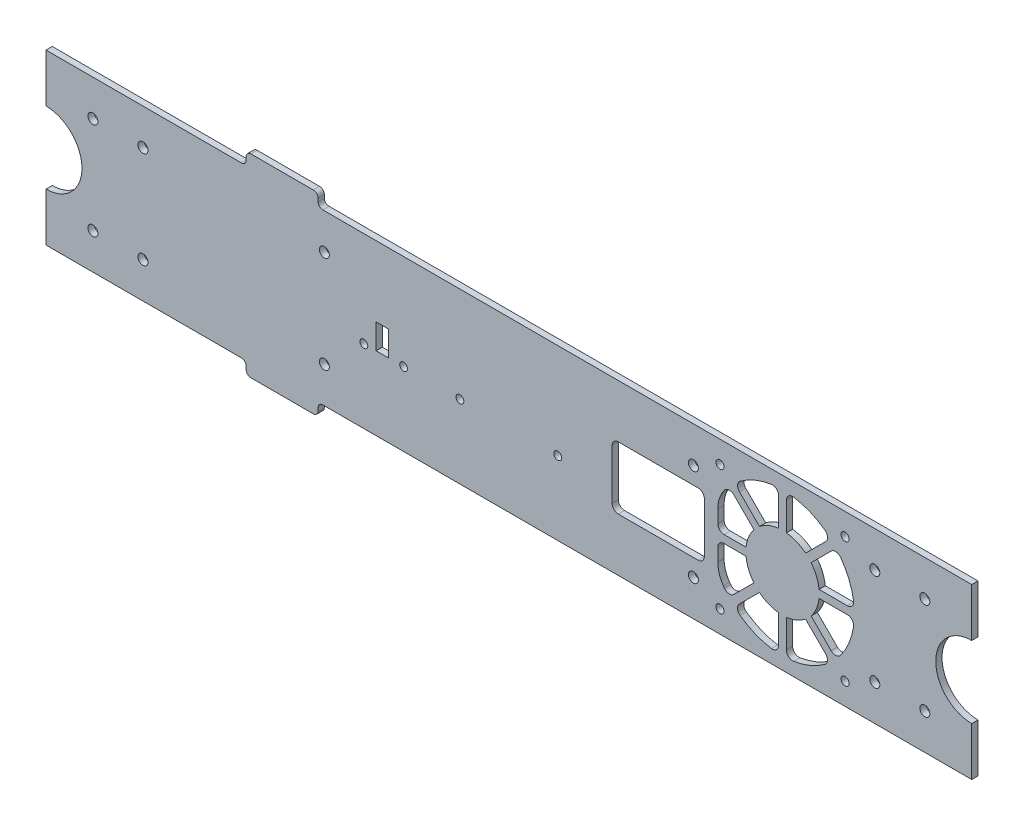
from build123d import *

# Parameters (mm, degrees)
SZKIC1_R                    = 1.6
SZKIC1_R_2                  = 1.25
SZKIC1_R_3                  = 1.3
SZKIC1_W                    = 4
SZKIC1_H                    = 8
DODANIE_WYCI_GNI_CIE2_DEPTH = 2


with BuildPart() as part:
    # Szkic1 → Dodanie-wyciągnięcie2 (new body)
    with BuildSketch(Plane.XY):
        with BuildLine():
            Line((-157.380716887, 25.645761596), (-157.380716887, 10.145761596))
            ThreePointArc((-157.380716887, 10.145761596), (-145.880716887, -1.354238404), (-157.380716887, -12.854238404))
            Line((-157.380716887, -12.854238404), (-157.380716887, -28.354238404))
            Line((-157.380716887, -28.354238404), (-94.880716887, -28.354238404))
            ThreePointArc((-94.880716887, -28.354238404), (-93.820056715, -28.793578232), (-93.380716887, -29.854238404))
            Line((-93.380716887, -29.854238404), (-93.380716887, -30.854238404))
            ThreePointArc((-93.380716887, -30.854238404), (-92.941377059, -31.914898575), (-91.880716887, -32.354238404))
            Line((-91.880716887, -32.354238404), (-71.880716887, -32.354238404))
            ThreePointArc((-71.880716887, -32.354238404), (-70.820056715, -31.914898575), (-70.380716887, -30.854238404))
            Line((-70.380716887, -30.854238404), (-70.380716887, -29.854238404))
            ThreePointArc((-70.380716887, -29.854238404), (-69.941377059, -28.793578232), (-68.880716887, -28.354238404))
            Line((-68.880716887, -28.354238404), (-54.387814563, -28.354238404))
            Line((-54.387814563, -28.354238404), (10.612185437, -28.354238404))
            Line((10.612185437, -28.354238404), (49.612185437, -28.354238404))
            Line((49.612185437, -28.354238404), (76.612185437, -28.354238404))
            Line((76.612185437, -28.354238404), (138.619283113, -28.354238404))
            Line((138.619283113, -28.354238404), (138.619283113, -12.854238404))
            ThreePointArc((138.619283113, -12.854238404), (127.119283113, -1.354238404), (138.619283113, 10.145761596))
            Line((138.619283113, 10.145761596), (138.619283113, 25.645761596))
            Line((138.619283113, 25.645761596), (76.612185437, 25.645761596))
            Line((76.612185437, 25.645761596), (49.612185437, 25.645761596))
            Line((49.612185437, 25.645761596), (-68.880716887, 25.645761596))
            ThreePointArc((-68.880716887, 25.645761596), (-69.941377059, 26.085101425), (-70.380716887, 27.145761596))
            Line((-70.380716887, 27.145761596), (-70.380716887, 28.145761596))
            ThreePointArc((-70.380716887, 28.145761596), (-70.820056715, 29.206421768), (-71.880716887, 29.645761596))
            Line((-71.880716887, 29.645761596), (-91.880716887, 29.645761596))
            ThreePointArc((-91.880716887, 29.645761596), (-92.941377059, 29.206421768), (-93.380716887, 28.145761596))
            Line((-93.380716887, 28.145761596), (-93.380716887, 27.145761596))
            ThreePointArc((-93.380716887, 27.145761596), (-93.820056715, 26.085101425), (-94.880716887, 25.645761596))
            Line((-94.880716887, 25.645761596), (-157.380716887, 25.645761596))
        make_face()
        with Locations((-126.387814563, -16.854238404)):
            Circle(SZKIC1_R, mode=Mode.SUBTRACT)
        with Locations((-126.380716887, 14.145761596)):
            Circle(SZKIC1_R, mode=Mode.SUBTRACT)
        with Locations((107.619283113, -16.854238404)):
            Circle(SZKIC1_R, mode=Mode.SUBTRACT)
        with Locations((107.619283113, 14.145761596)):
            Circle(SZKIC1_R, mode=Mode.SUBTRACT)
        with Locations((123.619283113, -16.854238404)):
            Circle(SZKIC1_R, mode=Mode.SUBTRACT)
        with Locations((123.619283113, 14.145761596)):
            Circle(SZKIC1_R, mode=Mode.SUBTRACT)
        with Locations((-142.387814563, -16.854237591)):
            Circle(SZKIC1_R, mode=Mode.SUBTRACT)
        with Locations((-142.380716887, 14.145761596)):
            Circle(SZKIC1_R, mode=Mode.SUBTRACT)
        with Locations((-43.037814563, -4.85389443)):
            Circle(SZKIC1_R_2, mode=Mode.SUBTRACT)
        with Locations((-25.037814563, -4.85389443)):
            Circle(SZKIC1_R_2, mode=Mode.SUBTRACT)
        with Locations((6.262185437, -4.85389443)):
            Circle(SZKIC1_R_2, mode=Mode.SUBTRACT)
        with Locations((58.119283113, -21.354238404)):
            Circle(SZKIC1_R_3, mode=Mode.SUBTRACT)
        with Locations((98.119283113, -21.354238404)):
            Circle(SZKIC1_R_3, mode=Mode.SUBTRACT)
        with Locations((98.119283113, 18.645761596)):
            Circle(SZKIC1_R_3, mode=Mode.SUBTRACT)
        with Locations((58.119283113, 18.645761596)):
            Circle(SZKIC1_R_3, mode=Mode.SUBTRACT)
        with Locations((-68.387814563, -16.854238404)):
            Circle(SZKIC1_R, mode=Mode.SUBTRACT)
        with Locations((-68.380716887, 14.145761596)):
            Circle(SZKIC1_R, mode=Mode.SUBTRACT)
        with Locations((49.619283113, -16.854238404)):
            Circle(SZKIC1_R, mode=Mode.SUBTRACT)
        with Locations((49.619283113, 14.145761596)):
            Circle(SZKIC1_R, mode=Mode.SUBTRACT)
        with Locations((-55.737814563, -4.85389443)):
            Circle(SZKIC1_R_2, mode=Mode.SUBTRACT)
        with BuildLine():
            Line((79.369283113, 19.384985726), (79.369283113, 10.329083042))
            ThreePointArc((79.369283113, 10.329083042), (82.616090095, 9.501231506), (85.497221579, 7.790624854))
            Line((85.497221579, 7.790624854), (91.906777401, 14.198994674))
            ThreePointArc((91.906777401, 14.198994674), (92.486674036, 15.768408091), (91.671114848, 17.229298844))
            ThreePointArc((91.671114848, 17.229298844), (86.925664761, 19.89305889), (81.687208557, 21.367335222))
            ThreePointArc((81.687208557, 21.367335222), (80.07170559, 20.909984733), (79.369283113, 19.384985726))
        make_face(mode=Mode.SUBTRACT)
        with BuildLine():
            Line((76.869283113, 19.393093303), (76.869283113, 10.329083042))
            ThreePointArc((76.869283113, 10.329083042), (73.623255004, 9.501554117), (70.74265698, 7.791683469))
            Line((70.74265698, 7.791683469), (64.334270116, 14.201256338))
            ThreePointArc((64.334270116, 14.201256338), (63.754662098, 15.770753709), (64.570455611, 17.231489275))
            ThreePointArc((64.570455611, 17.231489275), (69.31872127, 19.895470094), (74.560131496, 21.368711224))
            ThreePointArc((74.560131496, 21.368711224), (76.169581668, 20.912570792), (76.869283113, 19.393093303))
        make_face(mode=Mode.SUBTRACT)
        with BuildLine():
            Line((98.858507242, -0.104238404), (89.802604559, -0.104238404))
            ThreePointArc((89.802604559, -0.104238404), (88.974982211, 3.142015271), (87.264898428, 6.022767799))
            Line((87.264898428, 6.022767799), (93.674488351, 12.431171714))
            ThreePointArc((93.674488351, 12.431171714), (95.24396239, 13.01078155), (96.704693716, 12.195024039))
            ThreePointArc((96.704693716, 12.195024039), (99.367189094, 7.45067451), (100.840856739, 2.21368704))
            ThreePointArc((100.840856739, 2.21368704), (100.38350625, 0.598184073), (98.858507242, -0.104238404))
        make_face(mode=Mode.SUBTRACT)
        with BuildLine():
            Line((98.859839097, -2.604238404), (89.802604559, -2.604238404))
            ThreePointArc((89.802604559, -2.604238404), (88.972820396, -5.855707993), (87.257804535, -8.74003059))
            Line((87.257804535, -8.74003059), (93.666527985, -15.149940107))
            ThreePointArc((93.666527985, -15.149940107), (95.235459057, -15.729874195), (96.69626185, -14.915059213))
            ThreePointArc((96.69626185, -14.915059213), (99.364729025, -10.165085583), (100.841083042, -4.920722383))
            ThreePointArc((100.841083042, -4.920722383), (100.383931089, -3.306213804), (98.859839097, -2.604238404))
        make_face(mode=Mode.SUBTRACT)
        with BuildLine():
            Line((66.435961668, -0.104238404), (59.419283113, -0.104238404))
            ThreePointArc((59.419283113, -0.104238404), (58.005069551, 0.481548034), (57.419283113, 1.895761596))
            Line((57.419283113, 1.895761596), (57.419283113, 6.028850381))
            ThreePointArc((57.419283113, 6.028850381), (57.871830775, 9.003098832), (59.188513882, 11.708149446))
            ThreePointArc((59.188513882, 11.708149446), (59.360689238, 11.954223409), (59.536063013, 12.198028222))
            ThreePointArc((59.536063013, 12.198028222), (60.996949519, 13.013551408), (62.566339604, 12.433652958))
            Line((62.566339604, 12.433652958), (68.974726469, 6.024080089))
            ThreePointArc((68.974726469, 6.024080089), (67.263906643, 3.142794138), (66.435961668, -0.104238404))
        make_face(mode=Mode.SUBTRACT)
        with BuildLine():
            Line((76.869283113, -13.037559849), (76.869283113, -22.094794388))
            ThreePointArc((76.869283113, -22.094794388), (76.167307713, -23.61888638), (74.552799133, -24.076038333))
            ThreePointArc((74.552799133, -24.076038333), (69.308187359, -22.599581225), (64.558027599, -19.930899806))
            ThreePointArc((64.558027599, -19.930899806), (63.743248609, -18.470101278), (64.323184505, -16.901193536))
            Line((64.323184505, -16.901193536), (70.733111198, -10.492452914))
            ThreePointArc((70.733111198, -10.492452914), (73.617588025, -12.207682158), (76.869283113, -13.037559849))
        make_face(mode=Mode.SUBTRACT)
        with BuildLine():
            Line((79.369283113, -13.037559849), (79.369283113, -22.094794388))
            ThreePointArc((79.369283113, -22.094794388), (80.071258513, -23.61888638), (81.685767093, -24.076038333))
            ThreePointArc((81.685767093, -24.076038333), (86.918381525, -22.604552922), (91.659551787, -19.946202373))
            ThreePointArc((91.659551787, -19.946202373), (92.476053715, -18.485383553), (91.896481529, -16.91542715))
            Line((91.896481529, -16.91542715), (85.488428851, -10.506188529))
            ThreePointArc((85.488428851, -10.506188529), (82.610872865, -12.211868048), (79.369283113, -13.037559849))
        make_face(mode=Mode.SUBTRACT)
        with BuildLine():
            Line((66.435961668, -2.604238404), (59.419283113, -2.604238404))
            ThreePointArc((59.419283113, -2.604238404), (58.005069551, -3.190024841), (57.419283113, -4.604238404))
            Line((57.419283113, -4.604238404), (57.419283113, -8.737327188))
            ThreePointArc((57.419283113, -8.737327188), (57.871830775, -11.711575639), (59.188513882, -14.416626253))
            ThreePointArc((59.188513882, -14.416626253), (59.356239368, -14.656425795), (59.527002255, -14.89407195))
            ThreePointArc((59.527002255, -14.89407195), (60.987825298, -15.710609892), (62.557805033, -15.131039529))
            Line((62.557805033, -15.131039529), (68.967026729, -8.723003773))
            ThreePointArc((68.967026729, -8.723003773), (67.261560134, -5.845602529), (66.435961668, -2.604238404))
        make_face(mode=Mode.SUBTRACT)
        with BuildLine():
            Line((25.619283113, 8.645761596), (51.119283113, 8.645761596))
            ThreePointArc((51.119283113, 8.645761596), (52.533496676, 8.059975159), (53.119283113, 6.645761596))
            Line((53.119283113, 6.645761596), (53.119283113, -9.354238404))
            ThreePointArc((53.119283113, -9.354238404), (52.533496676, -10.768451966), (51.119283113, -11.354238404))
            Line((51.119283113, -11.354238404), (25.619283113, -11.354238404))
            ThreePointArc((25.619283113, -11.354238404), (24.205069551, -10.768451966), (23.619283113, -9.354238404))
            Line((23.619283113, -9.354238404), (23.619283113, 6.645761596))
            ThreePointArc((23.619283113, 6.645761596), (24.205069551, 8.059975159), (25.619283113, 8.645761596))
        make_face(mode=Mode.SUBTRACT)
        with Locations((-49.830596702, -0.85389443)):
            Rectangle(SZKIC1_W, SZKIC1_H, mode=Mode.SUBTRACT)
    extrude(amount=DODANIE_WYCI_GNI_CIE2_DEPTH)


solid = part.part
